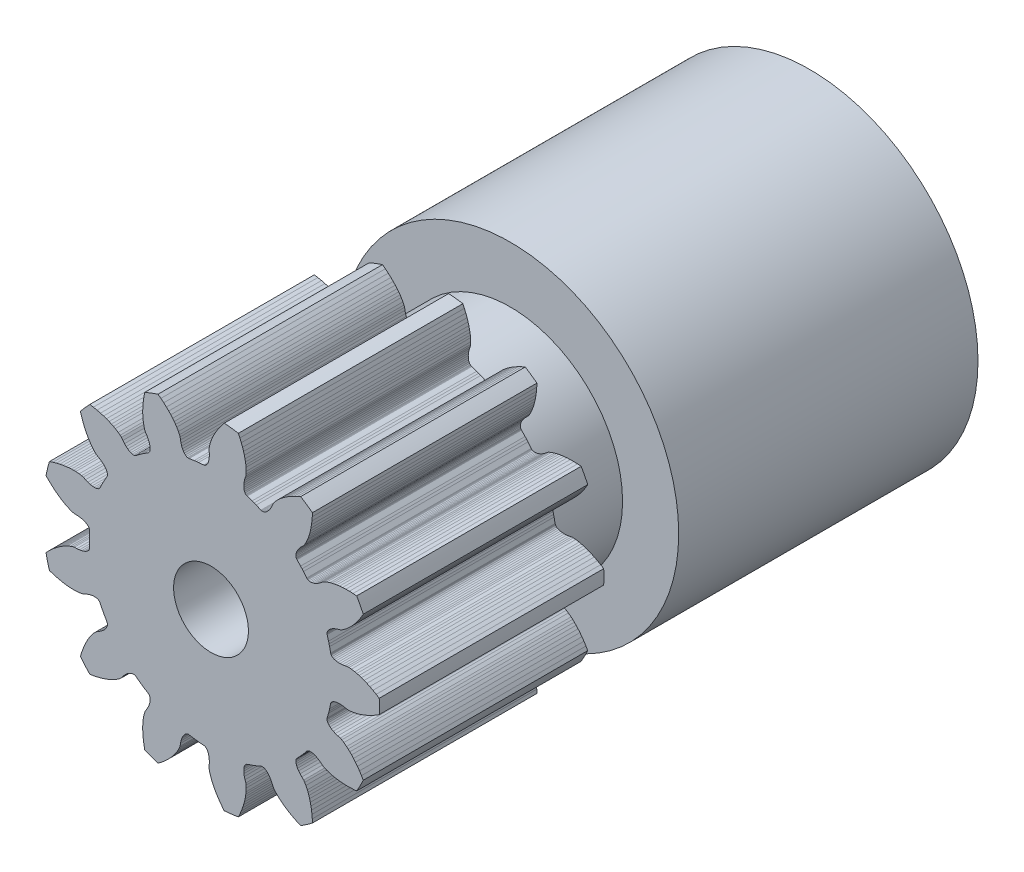
from build123d import *

# Parameters (mm, degrees)
MODEL_R                  = 1
BOSS_EXTRUDE1_DEPTH      = 6
SKETCH2_R                = 3
BOSS_EXTRUDE2_DEPTH      = 3
BOSS_EXTRUDE3_DEPTH      = 7
BOSS_EXTRUDE3_DEPTH_BACK = 1
SKETCH3_R                = 4.5
SKETCH3_R_2              = 3


with BuildPart() as part:
    # Model → Boss-Extrude1 (new body)
    with BuildSketch(Plane.XY):
        with BuildLine():
            Line((4.020960449, 1.838162727), (3.967506849, 1.754550827))
            Line((3.967506849, 1.754550827), (3.913165949, 1.676920427))
            Line((3.913165949, 1.676920427), (3.860130649, 1.607531927))
            Line((3.860130649, 1.607531927), (3.808930749, 1.546031927))
            Line((3.808930749, 1.546031927), (3.757913049, 1.489726527))
            Line((3.757913049, 1.489726527), (3.710533949, 1.441640627))
            Line((3.710533949, 1.441640627), (3.665075249, 1.399218927))
            Line((3.665075249, 1.399218927), (3.622763049, 1.362918127))
            Line((3.622763049, 1.362918127), (3.550404849, 1.308160527))
            Line((3.550404849, 1.308160527), (3.494773449, 1.272871627))
            Line((3.494773449, 1.272871627), (3.453410849, 1.251563727))
            Line((3.453410849, 1.251563727), (3.388067149, 1.234201427))
            Line((3.388067149, 1.234201427), (3.324147749, 1.211896427))
            Line((3.324147749, 1.211896427), (3.268050149, 1.186688927))
            Line((3.268050149, 1.186688927), (3.219890549, 1.159194627))
            Line((3.219890549, 1.159194627), (3.179772749, 1.130036527))
            Line((3.179772749, 1.130036527), (3.147718349, 1.099837927))
            Line((3.147718349, 1.099837927), (3.123739049, 1.069219527))
            Line((3.123739049, 1.069219527), (3.107802849, 1.038812227))
            Line((3.107802849, 1.038812227), (3.099841649, 1.009227227))
            Line((3.099841649, 1.009227227), (3.098824049, 0.994928227))
            Line((3.098824049, 0.994928227), (3.099745849, 0.981076327))
            Line((3.099745849, 0.981076327), (3.102595049, 0.967720027))
            Line((3.102595049, 0.967720027), (3.141130149, 0.834192027))
            Line((3.141130149, 0.834192027), (3.155560649, 0.777776127))
            Line((3.155560649, 0.777776127), (3.169000849, 0.721116127))
            Line((3.169000849, 0.721116127), (3.196933249, 0.584974827))
            Line((3.196933249, 0.584974827), (3.200617449, 0.571824327))
            Line((3.200617449, 0.571824327), (3.206238549, 0.559130727))
            Line((3.206238549, 0.559130727), (3.213784649, 0.546942427))
            Line((3.213784649, 0.546942427), (3.234582749, 0.524446027))
            Line((3.234582749, 0.524446027), (3.262824449, 0.504927527))
            Line((3.262824449, 0.504927527), (3.298286149, 0.488960127))
            Line((3.298286149, 0.488960127), (3.340702949, 0.477117027))
            Line((3.340702949, 0.477117027), (3.389775949, 0.469942427))
            Line((3.389775949, 0.469942427), (3.445196449, 0.467978327))
            Line((3.445196449, 0.467978327), (3.506582849, 0.471728027))
            Line((3.506582849, 0.471728027), (3.573546349, 0.481682727))
            Line((3.573546349, 0.481682727), (3.639473949, 0.496675927))
            Line((3.639473949, 0.496675927), (3.686001049, 0.497030927))
            Line((3.686001049, 0.497030927), (3.751659749, 0.491637327))
            Line((3.751659749, 0.491637327), (3.841176849, 0.476778427))
            Line((3.841176849, 0.476778427), (3.895512249, 0.464299027))
            Line((3.895512249, 0.464299027), (3.955478349, 0.447862227))
            Line((3.955478349, 0.447862227), (4.019777049, 0.427302527))
            Line((4.019777049, 0.427302527), (4.091117449, 0.401155627))
            Line((4.091117449, 0.401155627), (4.165033149, 0.370493827))
            Line((4.165033149, 0.370493827), (4.244240049, 0.333700127))
            Line((4.244240049, 0.333700127), (4.328433149, 0.290215227))
            Line((4.328433149, 0.290215227), (4.414620349, 0.241021727))
            Line((4.414620349, 0.241021727), (4.495964706, 0.190131327))
            ThreePointArc((4.495964706, 0.190131327), (4.499983142, 3.11e-07), (4.4959647, -0.190130705))
            Line((4.4959647, -0.190130705), (4.414620343, -0.241021105))
            Line((4.414620343, -0.241021105), (4.328433143, -0.290214605))
            Line((4.328433143, -0.290214605), (4.244240043, -0.333699505))
            Line((4.244240043, -0.333699505), (4.165033143, -0.370493205))
            Line((4.165033143, -0.370493205), (4.091117443, -0.401155005))
            Line((4.091117443, -0.401155005), (4.019777043, -0.427301905))
            Line((4.019777043, -0.427301905), (3.955478343, -0.447861605))
            Line((3.955478343, -0.447861605), (3.895512243, -0.464298405))
            Line((3.895512243, -0.464298405), (3.841176843, -0.476777805))
            Line((3.841176843, -0.476777805), (3.751659743, -0.491636705))
            Line((3.751659743, -0.491636705), (3.686001043, -0.497030305))
            Line((3.686001043, -0.497030305), (3.639473943, -0.496675305))
            Line((3.639473943, -0.496675305), (3.573546343, -0.481682105))
            Line((3.573546343, -0.481682105), (3.506582843, -0.471727405))
            Line((3.506582843, -0.471727405), (3.445196443, -0.467977705))
            Line((3.445196443, -0.467977705), (3.389775943, -0.469941805))
            Line((3.389775943, -0.469941805), (3.340702943, -0.477116405))
            Line((3.340702943, -0.477116405), (3.298286143, -0.488959505))
            Line((3.298286143, -0.488959505), (3.262824443, -0.504926905))
            Line((3.262824443, -0.504926905), (3.234582743, -0.524445405))
            Line((3.234582743, -0.524445405), (3.213784643, -0.546941805))
            Line((3.213784643, -0.546941805), (3.206238543, -0.559130105))
            Line((3.206238543, -0.559130105), (3.200617443, -0.571823705))
            Line((3.200617443, -0.571823705), (3.196933243, -0.584974205))
            Line((3.196933243, -0.584974205), (3.169000843, -0.721115505))
            Line((3.169000843, -0.721115505), (3.155560643, -0.777775505))
            Line((3.155560643, -0.777775505), (3.141130143, -0.834191405))
            Line((3.141130143, -0.834191405), (3.102595043, -0.967719405))
            Line((3.102595043, -0.967719405), (3.099745843, -0.981075705))
            Line((3.099745843, -0.981075705), (3.098824043, -0.994927605))
            Line((3.098824043, -0.994927605), (3.099841643, -1.009226605))
            Line((3.099841643, -1.009226605), (3.107802843, -1.038811605))
            Line((3.107802843, -1.038811605), (3.123739043, -1.069218905))
            Line((3.123739043, -1.069218905), (3.147718343, -1.099837305))
            Line((3.147718343, -1.099837305), (3.179772743, -1.130035905))
            Line((3.179772743, -1.130035905), (3.219890543, -1.159194005))
            Line((3.219890543, -1.159194005), (3.268050143, -1.186688305))
            Line((3.268050143, -1.186688305), (3.324147743, -1.211895805))
            Line((3.324147743, -1.211895805), (3.388067143, -1.234200805))
            Line((3.388067143, -1.234200805), (3.453410843, -1.251563105))
            Line((3.453410843, -1.251563105), (3.494773443, -1.272871005))
            Line((3.494773443, -1.272871005), (3.550404843, -1.308159905))
            Line((3.550404843, -1.308159905), (3.622763043, -1.362917505))
            Line((3.622763043, -1.362917505), (3.665075243, -1.399218305))
            Line((3.665075243, -1.399218305), (3.710533943, -1.441640005))
            Line((3.710533943, -1.441640005), (3.757913043, -1.489725905))
            Line((3.757913043, -1.489725905), (3.808930743, -1.546031305))
            Line((3.808930743, -1.546031305), (3.860130643, -1.607531305))
            Line((3.860130643, -1.607531305), (3.913165943, -1.676919805))
            Line((3.913165943, -1.676919805), (3.967506843, -1.754550205))
            Line((3.967506843, -1.754550205), (4.020960443, -1.838162105))
            Line((4.020960443, -1.838162105), (4.069337303, -1.921025984))
            ThreePointArc((4.069337303, -1.921025984), (3.984533848, -2.091253118), (3.892613508, -2.257745022))
            Line((3.892613508, -2.257745022), (3.796942629, -2.264989164))
            Line((3.796942629, -2.264989164), (3.697766229, -2.268494664))
            Line((3.697766229, -2.268494664), (3.603008529, -2.267872064))
            Line((3.603008529, -2.267872064), (3.515775329, -2.263641964))
            Line((3.515775329, -2.263641964), (3.436077029, -2.256441264))
            Line((3.436077029, -2.256441264), (3.360757129, -2.246439664))
            Line((3.360757129, -2.246439664), (3.294268929, -2.234763364))
            Line((3.294268929, -2.234763364), (3.233533029, -2.221449864))
            Line((3.233533029, -2.221449864), (3.179622029, -2.207248764))
            Line((3.179622029, -2.207248764), (3.093453229, -2.178804964))
            Line((3.093453229, -2.178804964), (3.032808829, -2.153067664))
            Line((3.032808829, -2.153067664), (2.991776129, -2.131131164))
            Line((2.991776129, -2.131131164), (2.940367829, -2.087217264))
            Line((2.940367829, -2.087217264), (2.885700729, -2.047283264))
            Line((2.885700729, -2.047283264), (2.833088329, -2.015435464))
            Line((2.833088329, -2.015435464), (2.783103129, -1.991419364))
            Line((2.783103129, -1.991419364), (2.736317029, -1.974966764))
            Line((2.736317029, -1.974966764), (2.693255029, -1.965741264))
            Line((2.693255029, -1.965741264), (2.654434829, -1.963399864))
            Line((2.654434829, -1.963399864), (2.620357329, -1.967558064))
            Line((2.620357329, -1.967558064), (2.591486929, -1.977812264))
            Line((2.591486929, -1.977812264), (2.579141029, -1.985097564))
            Line((2.579141029, -1.985097564), (2.568264729, -1.993724964))
            Line((2.568264729, -1.993724964), (2.558891229, -2.003656964))
            Line((2.558891229, -2.003656964), (2.470890229, -2.111223364))
            Line((2.470890229, -2.111223364), (2.432658329, -2.155147264))
            Line((2.432658329, -2.155147264), (2.393663029, -2.198394864))
            Line((2.393663029, -2.198394864), (2.297488229, -2.298719964))
            Line((2.297488229, -2.298719964), (2.288758529, -2.309222264))
            Line((2.288758529, -2.309222264), (2.281505029, -2.321059164))
            Line((2.281505029, -2.321059164), (2.275760929, -2.334193164))
            Line((2.275760929, -2.334193164), (2.269061429, -2.364089064))
            Line((2.269061429, -2.364089064), (2.269041229, -2.398419364))
            Line((2.269041229, -2.398419364), (2.276044829, -2.436674364))
            Line((2.276044829, -2.436674364), (2.290393529, -2.478310364))
            Line((2.290393529, -2.478310364), (2.312365629, -2.522772164))
            Line((2.312365629, -2.522772164), (2.342231629, -2.569498064))
            Line((2.342231629, -2.569498064), (2.380189029, -2.617888064))
            Line((2.380189029, -2.617888064), (2.426421229, -2.667343064))
            Line((2.426421229, -2.667343064), (2.476211529, -2.713083264))
            Line((2.476211529, -2.713083264), (2.502934029, -2.751172664))
            Line((2.502934029, -2.751172664), (2.535793629, -2.808272564))
            Line((2.535793629, -2.808272564), (2.574416529, -2.890384564))
            Line((2.574416529, -2.890384564), (2.595012229, -2.942190864))
            Line((2.595012229, -2.942190864), (2.615549629, -3.000879064))
            Line((2.615549629, -3.000879064), (2.635155129, -3.065475164))
            Line((2.635155129, -3.065475164), (2.654162529, -3.139040264))
            Line((2.654162529, -3.139040264), (2.670917329, -3.217289564))
            Line((2.670917329, -3.217289564), (2.685631329, -3.303376764))
            Line((2.685631329, -3.303376764), (2.697671129, -3.397368564))
            Line((2.697671129, -3.397368564), (2.706145629, -3.496244364))
            Line((2.706145629, -3.496244364), (2.710472443, -3.592098577))
            ThreePointArc((2.710472443, -3.592098577), (2.556281204, -3.703412892), (2.397524485, -3.808113032))
            Line((2.397524485, -3.808113032), (2.309433575, -3.770077019))
            Line((2.309433575, -3.770077019), (2.219988175, -3.727091419))
            Line((2.219988175, -3.727091419), (2.136373775, -3.682504019))
            Line((2.136373775, -3.682504019), (2.061098475, -3.638219219))
            Line((2.061098475, -3.638219219), (1.993875375, -3.594805719))
            Line((1.993875375, -3.594805719), (1.931830975, -3.550946819))
            Line((1.931830975, -3.550946819), (1.878384775, -3.509709319))
            Line((1.878384775, -3.509709319), (1.830792975, -3.469695419))
            Line((1.830792975, -3.469695419), (1.789656675, -3.432067319))
            Line((1.789656675, -3.432067319), (1.726576475, -3.366836919))
            Line((1.726576475, -3.366836919), (1.684839275, -3.315864819))
            Line((1.684839275, -3.315864819), (1.658700975, -3.277372119))
            Line((1.658700975, -3.277372119), (1.633588975, -3.214597619))
            Line((1.633588975, -3.214597619), (1.603741875, -3.153832819))
            Line((1.603741875, -3.153832819), (1.571956375, -3.101182719))
            Line((1.571956375, -3.101182719), (1.538857575, -3.056688319))
            Line((1.538857575, -3.056688319), (1.505076375, -3.020377719))
            Line((1.505076375, -3.020377719), (1.471234175, -2.992197019))
            Line((1.471234175, -2.992197019), (1.437948775, -2.972083119))
            Line((1.437948775, -2.972083119), (1.405842175, -2.959928419))
            Line((1.405842175, -2.959928419), (1.375513375, -2.955591319))
            Line((1.375513375, -2.955591319), (1.361195975, -2.956304719))
            Line((1.361195975, -2.956304719), (1.347556075, -2.958889419))
            Line((1.347556075, -2.958889419), (1.334640675, -2.963327719))
            Line((1.334640675, -2.963327719), (1.206731075, -3.017676919))
            Line((1.206731075, -3.017676919), (1.152465975, -3.038802419))
            Line((1.152465975, -3.038802419), (1.097839075, -3.058974219))
            Line((1.097839075, -3.058974219), (0.966057275, -3.103113019))
            Line((0.966057275, -3.103113019), (0.953446775, -3.108355419))
            Line((0.953446775, -3.108355419), (0.941523275, -3.115465619))
            Line((0.941523275, -3.115465619), (0.930333475, -3.124425819))
            Line((0.930333475, -3.124425819), (0.910507975, -3.147783919))
            Line((0.910507975, -3.147783919), (0.894535975, -3.178172419))
            Line((0.894535975, -3.178172419), (0.882959375, -3.215300219))
            Line((0.882959375, -3.215300219), (0.876315375, -3.258835319))
            Line((0.876315375, -3.258835319), (0.875108275, -3.308415219))
            Line((0.875108275, -3.308415219), (0.879838675, -3.363668419))
            Line((0.879838675, -3.363668419), (0.890960375, -3.424155219))
            Line((0.890960375, -3.424155219), (0.908913975, -3.489430619))
            Line((0.908913975, -3.489430619), (0.931744575, -3.553070319))
            Line((0.931744575, -3.553070319), (0.937705175, -3.599215419))
            Line((0.937705175, -3.599215419), (0.940265175, -3.665045419))
            Line((0.940265175, -3.665045419), (0.936304775, -3.755701019))
            Line((0.936304775, -3.755701019), (0.930465775, -3.811144419))
            Line((0.930465775, -3.811144419), (0.921376975, -3.872654519))
            Line((0.921376975, -3.872654519), (0.908717475, -3.938962619))
            Line((0.908717475, -3.938962619), (0.891360375, -4.012934519))
            Line((0.891360375, -4.012934519), (0.869831675, -4.090007119))
            Line((0.869831675, -4.090007119), (0.842853575, -4.173071519))
            Line((0.842853575, -4.173071519), (0.809834075, -4.261892319))
            Line((0.809834075, -4.261892319), (0.771387975, -4.353380719))
            Line((0.771387975, -4.353380719), (0.730666519, -4.440281399))
            ThreePointArc((0.730666519, -4.440281399), (0.542398565, -4.467189549), (0.353161793, -4.486118774))
            Line((0.353161793, -4.486118774), (0.292859575, -4.411484619))
            Line((0.292859575, -4.411484619), (0.233636075, -4.331855419))
            Line((0.233636075, -4.331855419), (0.180319875, -4.253517719))
            Line((0.180319875, -4.253517719), (0.134247075, -4.179323319))
            Line((0.134247075, -4.179323319), (0.094899275, -4.109642419))
            Line((0.094899275, -4.109642419), (0.060343875, -4.041973819))
            Line((0.060343875, -4.041973819), (0.032183675, -3.980622119))
            Line((0.032183675, -3.980622119), (0.008638675, -3.923074519))
            Line((0.008638675, -3.923074519), (-0.010299125, -3.870639519))
            Line((-0.010299125, -3.870639519), (-0.035839825, -3.783566019))
            Line((-0.035839825, -3.783566019), (-0.049108325, -3.719036219))
            Line((-0.049108325, -3.719036219), (-0.054364125, -3.672805619))
            Line((-0.054364125, -3.672805619), (-0.047426925, -3.605551419))
            Line((-0.047426925, -3.605551419), (-0.045616425, -3.537876219))
            Line((-0.045616425, -3.537876219), (-0.049293425, -3.476485419))
            Line((-0.049293425, -3.476485419), (-0.057923325, -3.421705819))
            Line((-0.057923325, -3.421705819), (-0.070960725, -3.373855419))
            Line((-0.070960725, -3.373855419), (-0.087830225, -3.333175419))
            Line((-0.087830225, -3.333175419), (-0.107955725, -3.299896919))
            Line((-0.107955725, -3.299896919), (-0.130736025, -3.274213819))
            Line((-0.130736025, -3.274213819), (-0.155575325, -3.256279019))
            Line((-0.155575325, -3.256279019), (-0.168584325, -3.250257019))
            Line((-0.168584325, -3.250257019), (-0.181862925, -3.246206919))
            Line((-0.181862925, -3.246206919), (-0.195361625, -3.244134719))
            Line((-0.195361625, -3.244134719), (-0.333877225, -3.232816019))
            Line((-0.333877225, -3.232816019), (-0.391744125, -3.226303419))
            Line((-0.391744125, -3.226303419), (-0.449488125, -3.218778319))
            Line((-0.449488125, -3.218778319), (-0.586687425, -3.196619219))
            Line((-0.586687425, -3.196619219), (-0.600289725, -3.195400719))
            Line((-0.600289725, -3.195400719), (-0.614151825, -3.196155319))
            Line((-0.614151825, -3.196155319), (-0.628223925, -3.198889119))
            Line((-0.628223925, -3.198889119), (-0.656633525, -3.210358319))
            Line((-0.656633525, -3.210358319), (-0.684898225, -3.229843419))
            Line((-0.684898225, -3.229843419), (-0.712402925, -3.257338619))
            Line((-0.712402925, -3.257338619), (-0.738517725, -3.292799319))
            Line((-0.738517725, -3.292799319), (-0.762627525, -3.336139219))
            Line((-0.762627525, -3.336139219), (-0.784116325, -3.387261819))
            Line((-0.784116325, -3.387261819), (-0.802378225, -3.445988719))
            Line((-0.802378225, -3.445988719), (-0.816816025, -3.512130719))
            Line((-0.816816025, -3.512130719), (-0.826175425, -3.579090819))
            Line((-0.826175425, -3.579090819), (-0.842342225, -3.622720219))
            Line((-0.842342225, -3.622720219), (-0.870668225, -3.682199519))
            Line((-0.870668225, -3.682199519), (-0.916304825, -3.760630519))
            Line((-0.916304825, -3.760630519), (-0.947240725, -3.807009719))
            Line((-0.947240725, -3.807009719), (-0.983873725, -3.857250419))
            Line((-0.983873725, -3.857250419), (-1.025898025, -3.910080119))
            Line((-1.025898025, -3.910080119), (-1.075643425, -3.967512719))
            Line((-1.075643425, -3.967512719), (-1.130523625, -4.025752319))
            Line((-1.130523625, -4.025752319), (-1.193013425, -4.086764819))
            Line((-1.193013425, -4.086764819), (-1.263527825, -4.150066819))
            Line((-1.263527825, -4.150066819), (-1.340086925, -4.213209019))
            Line((-1.340086925, -4.213209019), (-1.416515424, -4.271221308))
            ThreePointArc((-1.416515424, -4.271221308), (-1.595716032, -4.207557219), (-1.772066723, -4.136378514))
            Line((-1.772066723, -4.136378514), (-1.790805025, -4.042274219))
            Line((-1.790805025, -4.042274219), (-1.806239325, -3.944243519))
            Line((-1.806239325, -3.944243519), (-1.817043125, -3.850101619))
            Line((-1.817043125, -3.850101619), (-1.823358625, -3.762994619))
            Line((-1.823358625, -3.762994619), (-1.825817025, -3.683009419))
            Line((-1.825817025, -3.683009419), (-1.824967225, -3.607033219))
            Line((-1.824967225, -3.607033219), (-1.821390225, -3.539622319))
            Line((-1.821390225, -3.539622319), (-1.815494625, -3.477724419))
            Line((-1.815494625, -3.477724419), (-1.807895425, -3.422494819))
            Line((-1.807895425, -3.422494819), (-1.790045525, -3.333525719))
            Line((-1.790045525, -3.333525719), (-1.771805725, -3.270221219))
            Line((-1.771805725, -3.270221219), (-1.754975125, -3.226843519))
            Line((-1.754975125, -3.226843519), (-1.717577925, -3.170516819))
            Line((-1.717577925, -3.170516819), (-1.684524625, -3.111434719))
            Line((-1.684524625, -3.111434719), (-1.659250625, -3.055367119))
            Line((-1.659250625, -3.055367119), (-1.641434725, -3.002851619))
            Line((-1.641434725, -3.002851619), (-1.630741525, -2.954423519))
            Line((-1.630741525, -2.954423519), (-1.626773825, -2.910563419))
            Line((-1.626773825, -2.910563419), (-1.629128825, -2.871744019))
            Line((-1.629128825, -2.871744019), (-1.637364225, -2.838416219))
            Line((-1.637364225, -2.838416219), (-1.651023625, -2.810992319))
            Line((-1.651023625, -2.810992319), (-1.659743925, -2.799614519))
            Line((-1.659743925, -2.799614519), (-1.669619425, -2.789857519))
            Line((-1.669619425, -2.789857519), (-1.680608925, -2.781749519))
            Line((-1.680608925, -2.781749519), (-1.797998325, -2.707355919))
            Line((-1.797998325, -2.707355919), (-1.846210325, -2.674697219))
            Line((-1.846210325, -2.674697219), (-1.893843025, -2.641199019))
            Line((-1.893843025, -2.641199019), (-2.005029125, -2.557818419))
            Line((-2.005029125, -2.557818419), (-2.016507125, -2.550418219))
            Line((-2.016507125, -2.550418219), (-2.029132025, -2.544644419))
            Line((-2.029132025, -2.544644419), (-2.042862725, -2.540525319))
            Line((-2.042862725, -2.540525319), (-2.073348125, -2.537478219))
            Line((-2.073348125, -2.537478219), (-2.107430525, -2.541596219))
            Line((-2.107430525, -2.541596219), (-2.144562425, -2.553159819))
            Line((-2.144562425, -2.553159819), (-2.184165325, -2.572422619))
            Line((-2.184165325, -2.572422619), (-2.225654525, -2.599593819))
            Line((-2.225654525, -2.599593819), (-2.268439725, -2.634874219))
            Line((-2.268439725, -2.634874219), (-2.311901625, -2.678387619))
            Line((-2.311901625, -2.678387619), (-2.355423425, -2.730243819))
            Line((-2.355423425, -2.730243819), (-2.394828625, -2.785184519))
            Line((-2.394828625, -2.785184519), (-2.429419225, -2.816303419))
            Line((-2.429419225, -2.816303419), (-2.482142025, -2.855806019))
            Line((-2.482142025, -2.855806019), (-2.558999925, -2.904044819))
            Line((-2.558999925, -2.904044819), (-2.607945825, -2.930734919))
            Line((-2.607945825, -2.930734919), (-2.663730725, -2.958196719))
            Line((-2.663730725, -2.958196719), (-2.725492625, -2.985445419))
            Line((-2.725492625, -2.985445419), (-2.796230225, -3.013181519))
            Line((-2.796230225, -3.013181519), (-2.871889425, -3.039246019))
            Line((-2.871889425, -3.039246019), (-2.955575425, -3.064229519))
            Line((-2.955575425, -3.064229519), (-3.047430725, -3.087510919))
            Line((-3.047430725, -3.087510919), (-3.144564125, -3.107841819))
            Line((-3.144564125, -3.107841819), (-3.239221247, -3.123707795))
            ThreePointArc((-3.239221247, -3.123707795), (-3.368314838, -2.984051642), (-3.491392233, -2.839065604))
            Line((-3.491392233, -2.839065604), (-3.464217725, -2.747027419))
            Line((-3.464217725, -2.747027419), (-3.432327025, -2.653052819))
            Line((-3.432327025, -2.653052819), (-3.398143325, -2.564673519))
            Line((-3.398143325, -2.564673519), (-3.363254925, -2.484609219))
            Line((-3.363254925, -2.484609219), (-3.328260725, -2.412643319))
            Line((-3.328260725, -2.412643319), (-3.292200225, -2.345764619))
            Line((-3.292200225, -2.345764619), (-3.257705625, -2.287737519))
            Line((-3.257705625, -2.287737519), (-3.223720025, -2.235669519))
            Line((-3.223720025, -2.235669519), (-3.191324725, -2.190297619))
            Line((-3.191324725, -2.190297619), (-3.134173425, -2.119814719))
            Line((-3.134173425, -2.119814719), (-3.088603825, -2.072237819))
            Line((-3.088603825, -2.072237819), (-3.053542425, -2.041650319))
            Line((-3.053542425, -2.041650319), (-2.994252525, -2.009154819))
            Line((-2.994252525, -2.009154819), (-2.937528425, -1.972201019))
            Line((-2.937528425, -1.972201019), (-2.889093525, -1.934300919))
            Line((-2.889093525, -1.934300919), (-2.848913225, -1.896080219))
            Line((-2.848913225, -1.896080219), (-2.816939125, -1.858168619))
            Line((-2.816939125, -1.858168619), (-2.793043125, -1.821176319))
            Line((-2.793043125, -1.821176319), (-2.777088025, -1.785709119))
            Line((-2.777088025, -1.785709119), (-2.768892025, -1.752371519))
            Line((-2.768892025, -1.752371519), (-2.768242225, -1.721741119))
            Line((-2.768242225, -1.721741119), (-2.770676225, -1.707614019))
            Line((-2.770676225, -1.707614019), (-2.774886125, -1.694385219))
            Line((-2.774886125, -1.694385219), (-2.780848925, -1.682098919))
            Line((-2.780848925, -1.682098919), (-2.850219625, -1.561673019))
            Line((-2.850219625, -1.561673019), (-2.877732025, -1.510349919))
            Line((-2.877732025, -1.510349919), (-2.904341225, -1.458552819))
            Line((-2.904341225, -1.458552819), (-2.964042725, -1.333052119))
            Line((-2.964042725, -1.333052119), (-2.970767025, -1.321165519))
            Line((-2.970767025, -1.321165519), (-2.979262525, -1.310185919))
            Line((-2.979262525, -1.310185919), (-2.989506225, -1.300157719))
            Line((-2.989506225, -1.300157719), (-3.015083725, -1.283292419))
            Line((-3.015083725, -1.283292419), (-3.047175925, -1.271099719))
            Line((-3.047175925, -1.271099719), (-3.085428425, -1.264082819))
            Line((-3.085428425, -1.264082819), (-3.129446925, -1.262734819))
            Line((-3.129446925, -1.262734819), (-3.178810825, -1.267512719))
            Line((-3.178810825, -1.267512719), (-3.233090925, -1.278868719))
            Line((-3.233090925, -1.278868719), (-3.291796225, -1.297200119))
            Line((-3.291796225, -1.297200119), (-3.354431625, -1.322891019))
            Line((-3.354431625, -1.322891019), (-3.414855425, -1.353226019))
            Line((-3.414855425, -1.353226019), (-3.459945525, -1.364705319))
            Line((-3.459945525, -1.364705319), (-3.524987025, -1.375181619))
            Line((-3.524987025, -1.375181619), (-3.615458925, -1.382177319))
            Line((-3.615458925, -1.382177319), (-3.671201925, -1.383063919))
            Line((-3.671201925, -1.383063919), (-3.733359125, -1.381455619))
            Line((-3.733359125, -1.381455619), (-3.800709625, -1.376880919))
            Line((-3.800709625, -1.376880919), (-3.876234425, -1.368566719))
            Line((-3.876234425, -1.368566719), (-3.955340125, -1.356485119))
            Line((-3.955340125, -1.356485119), (-4.041050725, -1.339716019))
            Line((-4.041050725, -1.339716019), (-4.133203925, -1.317643419))
            Line((-4.133203925, -1.317643419), (-4.228659525, -1.290505319))
            Line((-4.228659525, -1.290505319), (-4.319818995, -1.260560712))
            ThreePointArc((-4.319818995, -1.260560712), (-4.36922202, -1.07691614), (-4.410821696, -0.891348216))
            Line((-4.410821696, -0.891348216), (-4.344019925, -0.822469619))
            Line((-4.344019925, -0.822469619), (-4.272109925, -0.754079619))
            Line((-4.272109925, -0.754079619), (-4.200769925, -0.691709619))
            Line((-4.200769925, -0.691709619), (-4.132669925, -0.637029619))
            Line((-4.132669925, -0.637029619), (-4.068239925, -0.589569619))
            Line((-4.068239925, -0.589569619), (-4.005229925, -0.547109619))
            Line((-4.005229925, -0.547109619), (-3.947719925, -0.511759619))
            Line((-3.947719925, -0.511759619), (-3.893429925, -0.481449619))
            Line((-3.893429925, -0.481449619), (-3.843659925, -0.456329619))
            Line((-3.843659925, -0.456329619), (-3.760299925, -0.420479619))
            Line((-3.760299925, -0.420479619), (-3.697839925, -0.399529619))
            Line((-3.697839925, -0.399529619), (-3.652579925, -0.388739619))
            Line((-3.652579925, -0.388739619), (-3.584979925, -0.387519619))
            Line((-3.584979925, -0.387519619), (-3.517579925, -0.381159619))
            Line((-3.517579925, -0.381159619), (-3.457079925, -0.370109619))
            Line((-3.457079925, -0.370109619), (-3.403739925, -0.354939619))
            Line((-3.403739925, -0.354939619), (-3.357809925, -0.336229619))
            Line((-3.357809925, -0.336229619), (-3.319459925, -0.314579619))
            Line((-3.319459925, -0.314579619), (-3.288849925, -0.290589619))
            Line((-3.288849925, -0.290589619), (-3.266099925, -0.264879619))
            Line((-3.266099925, -0.264879619), (-3.251289925, -0.238059619))
            Line((-3.251289925, -0.238059619), (-3.246879925, -0.224419619))
            Line((-3.246879925, -0.224419619), (-3.244459925, -0.210749619))
            Line((-3.244459925, -0.210749619), (-3.244029925, -0.197099619))
            Line((-3.244029925, -0.197099619), (-3.249489925, -0.058229619))
            Line((-3.249489925, -0.058229619), (-3.249999925, 3.81e-07))
            Line((-3.249999925, 3.81e-07), (-3.249489925, 0.058230381))
            Line((-3.249489925, 0.058230381), (-3.244029925, 0.197100381))
            Line((-3.244029925, 0.197100381), (-3.244459925, 0.210750381))
            Line((-3.244459925, 0.210750381), (-3.246879925, 0.224420381))
            Line((-3.246879925, 0.224420381), (-3.251289925, 0.238060381))
            Line((-3.251289925, 0.238060381), (-3.266099925, 0.264880381))
            Line((-3.266099925, 0.264880381), (-3.288849925, 0.290590381))
            Line((-3.288849925, 0.290590381), (-3.319459925, 0.314580381))
            Line((-3.319459925, 0.314580381), (-3.357809925, 0.336230381))
            Line((-3.357809925, 0.336230381), (-3.403739925, 0.354940381))
            Line((-3.403739925, 0.354940381), (-3.457079925, 0.370110381))
            Line((-3.457079925, 0.370110381), (-3.517579925, 0.381160381))
            Line((-3.517579925, 0.381160381), (-3.584979925, 0.387520381))
            Line((-3.584979925, 0.387520381), (-3.652579925, 0.388740381))
            Line((-3.652579925, 0.388740381), (-3.697839925, 0.399530381))
            Line((-3.697839925, 0.399530381), (-3.760299925, 0.420480381))
            Line((-3.760299925, 0.420480381), (-3.843659925, 0.456330381))
            Line((-3.843659925, 0.456330381), (-3.893429925, 0.481450381))
            Line((-3.893429925, 0.481450381), (-3.947719925, 0.511760381))
            Line((-3.947719925, 0.511760381), (-4.005229925, 0.547110381))
            Line((-4.005229925, 0.547110381), (-4.068239925, 0.589570381))
            Line((-4.068239925, 0.589570381), (-4.132669925, 0.637030381))
            Line((-4.132669925, 0.637030381), (-4.200769925, 0.691710381))
            Line((-4.200769925, 0.691710381), (-4.272109925, 0.754080381))
            Line((-4.272109925, 0.754080381), (-4.344019925, 0.822470381))
            Line((-4.344019925, 0.822470381), (-4.41085591, 0.891345384))
            ThreePointArc((-4.41085591, 0.891345384), (-4.369254636, 1.076921143), (-4.319849356, 1.260573388))
            Line((-4.319849356, 1.260573388), (-4.228659525, 1.290506081))
            Line((-4.228659525, 1.290506081), (-4.133203925, 1.317644181))
            Line((-4.133203925, 1.317644181), (-4.041050725, 1.339716781))
            Line((-4.041050725, 1.339716781), (-3.955340125, 1.356485881))
            Line((-3.955340125, 1.356485881), (-3.876234425, 1.368567481))
            Line((-3.876234425, 1.368567481), (-3.800709625, 1.376881681))
            Line((-3.800709625, 1.376881681), (-3.733359125, 1.381456381))
            Line((-3.733359125, 1.381456381), (-3.671201925, 1.383064681))
            Line((-3.671201925, 1.383064681), (-3.615458925, 1.382178081))
            Line((-3.615458925, 1.382178081), (-3.524987025, 1.375182381))
            Line((-3.524987025, 1.375182381), (-3.459945525, 1.364706081))
            Line((-3.459945525, 1.364706081), (-3.414855425, 1.353226781))
            Line((-3.414855425, 1.353226781), (-3.354431625, 1.322891781))
            Line((-3.354431625, 1.322891781), (-3.291796225, 1.297200881))
            Line((-3.291796225, 1.297200881), (-3.233090925, 1.278869481))
            Line((-3.233090925, 1.278869481), (-3.178810825, 1.267513481))
            Line((-3.178810825, 1.267513481), (-3.129446925, 1.262735581))
            Line((-3.129446925, 1.262735581), (-3.085428425, 1.264083581))
            Line((-3.085428425, 1.264083581), (-3.047175925, 1.271100481))
            Line((-3.047175925, 1.271100481), (-3.015083725, 1.283293181))
            Line((-3.015083725, 1.283293181), (-2.989506225, 1.300158481))
            Line((-2.989506225, 1.300158481), (-2.979262525, 1.310186681))
            Line((-2.979262525, 1.310186681), (-2.970767025, 1.321166281))
            Line((-2.970767025, 1.321166281), (-2.964042725, 1.333052881))
            Line((-2.964042725, 1.333052881), (-2.904341225, 1.458553581))
            Line((-2.904341225, 1.458553581), (-2.877732025, 1.510350681))
            Line((-2.877732025, 1.510350681), (-2.850219625, 1.561673781))
            Line((-2.850219625, 1.561673781), (-2.780848925, 1.682099681))
            Line((-2.780848925, 1.682099681), (-2.774886125, 1.694385981))
            Line((-2.774886125, 1.694385981), (-2.770676225, 1.707614781))
            Line((-2.770676225, 1.707614781), (-2.768242225, 1.721741881))
            Line((-2.768242225, 1.721741881), (-2.768892025, 1.752372281))
            Line((-2.768892025, 1.752372281), (-2.777088025, 1.785709881))
            Line((-2.777088025, 1.785709881), (-2.793043125, 1.821177081))
            Line((-2.793043125, 1.821177081), (-2.816939125, 1.858169381))
            Line((-2.816939125, 1.858169381), (-2.848913225, 1.896080981))
            Line((-2.848913225, 1.896080981), (-2.889093525, 1.934301681))
            Line((-2.889093525, 1.934301681), (-2.937528425, 1.972201781))
            Line((-2.937528425, 1.972201781), (-2.994252525, 2.009155581))
            Line((-2.994252525, 2.009155581), (-3.053542425, 2.041651081))
            Line((-3.053542425, 2.041651081), (-3.088603825, 2.072238581))
            Line((-3.088603825, 2.072238581), (-3.134173425, 2.119815481))
            Line((-3.134173425, 2.119815481), (-3.191324725, 2.190298381))
            Line((-3.191324725, 2.190298381), (-3.223720025, 2.235670281))
            Line((-3.223720025, 2.235670281), (-3.257705625, 2.287738281))
            Line((-3.257705625, 2.287738281), (-3.292200225, 2.345765381))
            Line((-3.292200225, 2.345765381), (-3.328260725, 2.412644081))
            Line((-3.328260725, 2.412644081), (-3.363254925, 2.484609981))
            Line((-3.363254925, 2.484609981), (-3.398143325, 2.564674281))
            Line((-3.398143325, 2.564674281), (-3.432327025, 2.653053581))
            Line((-3.432327025, 2.653053581), (-3.464217725, 2.747028181))
            Line((-3.464217725, 2.747028181), (-3.49135833, 2.839061487))
            ThreePointArc((-3.49135833, 2.839061487), (-3.36828584, 2.984041167), (-3.239197667, 3.123691405))
            Line((-3.239197667, 3.123691405), (-3.144563963, 3.107842203))
            Line((-3.144563963, 3.107842203), (-3.047430563, 3.087511303))
            Line((-3.047430563, 3.087511303), (-2.955575263, 3.064229903))
            Line((-2.955575263, 3.064229903), (-2.871889263, 3.039246403))
            Line((-2.871889263, 3.039246403), (-2.796230063, 3.013181903))
            Line((-2.796230063, 3.013181903), (-2.725492463, 2.985445803))
            Line((-2.725492463, 2.985445803), (-2.663730563, 2.958197103))
            Line((-2.663730563, 2.958197103), (-2.607945663, 2.930735303))
            Line((-2.607945663, 2.930735303), (-2.558999763, 2.904045203))
            Line((-2.558999763, 2.904045203), (-2.482141863, 2.855806403))
            Line((-2.482141863, 2.855806403), (-2.429419063, 2.816303803))
            Line((-2.429419063, 2.816303803), (-2.394828463, 2.785184903))
            Line((-2.394828463, 2.785184903), (-2.355423263, 2.730244203))
            Line((-2.355423263, 2.730244203), (-2.311901463, 2.678388003))
            Line((-2.311901463, 2.678388003), (-2.268439563, 2.634874603))
            Line((-2.268439563, 2.634874603), (-2.225654363, 2.599594203))
            Line((-2.225654363, 2.599594203), (-2.184165163, 2.572423003))
            Line((-2.184165163, 2.572423003), (-2.144562263, 2.553160203))
            Line((-2.144562263, 2.553160203), (-2.107430363, 2.541596603))
            Line((-2.107430363, 2.541596603), (-2.073347963, 2.537478603))
            Line((-2.073347963, 2.537478603), (-2.042862563, 2.540525703))
            Line((-2.042862563, 2.540525703), (-2.029131863, 2.544644803))
            Line((-2.029131863, 2.544644803), (-2.016506963, 2.550418603))
            Line((-2.016506963, 2.550418603), (-2.005028963, 2.557818803))
            Line((-2.005028963, 2.557818803), (-1.893842863, 2.641199403))
            Line((-1.893842863, 2.641199403), (-1.846210163, 2.674697603))
            Line((-1.846210163, 2.674697603), (-1.797998163, 2.707356303))
            Line((-1.797998163, 2.707356303), (-1.680608763, 2.781749903))
            Line((-1.680608763, 2.781749903), (-1.669619263, 2.789857903))
            Line((-1.669619263, 2.789857903), (-1.659743763, 2.799614903))
            Line((-1.659743763, 2.799614903), (-1.651023463, 2.810992703))
            Line((-1.651023463, 2.810992703), (-1.637364063, 2.838416603))
            Line((-1.637364063, 2.838416603), (-1.629128663, 2.871744403))
            Line((-1.629128663, 2.871744403), (-1.626773663, 2.910563803))
            Line((-1.626773663, 2.910563803), (-1.630741363, 2.954423903))
            Line((-1.630741363, 2.954423903), (-1.641434563, 3.002852003))
            Line((-1.641434563, 3.002852003), (-1.659250463, 3.055367503))
            Line((-1.659250463, 3.055367503), (-1.684524463, 3.111435103))
            Line((-1.684524463, 3.111435103), (-1.717577763, 3.170517203))
            Line((-1.717577763, 3.170517203), (-1.754974963, 3.226843903))
            Line((-1.754974963, 3.226843903), (-1.771805563, 3.270221603))
            Line((-1.771805563, 3.270221603), (-1.790045363, 3.333526103))
            Line((-1.790045363, 3.333526103), (-1.807895263, 3.422495203))
            Line((-1.807895263, 3.422495203), (-1.815494463, 3.477724803))
            Line((-1.815494463, 3.477724803), (-1.821390063, 3.539622703))
            Line((-1.821390063, 3.539622703), (-1.824967063, 3.607033603))
            Line((-1.824967063, 3.607033603), (-1.825816863, 3.683009803))
            Line((-1.825816863, 3.683009803), (-1.823358463, 3.762995003))
            Line((-1.823358463, 3.762995003), (-1.817042963, 3.850102003))
            Line((-1.817042963, 3.850102003), (-1.806239163, 3.944243903))
            Line((-1.806239163, 3.944243903), (-1.790804863, 4.042274603))
            Line((-1.790804863, 4.042274603), (-1.772095691, 4.136391529))
            ThreePointArc((-1.772095691, 4.136391529), (-1.595738395, 4.207573079), (-1.416530966, 4.271239445))
            Line((-1.416530966, 4.271239445), (-1.340086843, 4.213209375))
            Line((-1.340086843, 4.213209375), (-1.263527743, 4.150067175))
            Line((-1.263527743, 4.150067175), (-1.193013343, 4.086765175))
            Line((-1.193013343, 4.086765175), (-1.130523543, 4.025752675))
            Line((-1.130523543, 4.025752675), (-1.075643343, 3.967513075))
            Line((-1.075643343, 3.967513075), (-1.025897943, 3.910080475))
            Line((-1.025897943, 3.910080475), (-0.983873643, 3.857250775))
            Line((-0.983873643, 3.857250775), (-0.947240643, 3.807010075))
            Line((-0.947240643, 3.807010075), (-0.916304743, 3.760630875))
            Line((-0.916304743, 3.760630875), (-0.870668143, 3.682199875))
            Line((-0.870668143, 3.682199875), (-0.842342143, 3.622720575))
            Line((-0.842342143, 3.622720575), (-0.826175343, 3.579091175))
            Line((-0.826175343, 3.579091175), (-0.816815943, 3.512131075))
            Line((-0.816815943, 3.512131075), (-0.802378143, 3.445989075))
            Line((-0.802378143, 3.445989075), (-0.784116243, 3.387262175))
            Line((-0.784116243, 3.387262175), (-0.762627443, 3.336139575))
            Line((-0.762627443, 3.336139575), (-0.738517643, 3.292799675))
            Line((-0.738517643, 3.292799675), (-0.712402843, 3.257338975))
            Line((-0.712402843, 3.257338975), (-0.684898143, 3.229843775))
            Line((-0.684898143, 3.229843775), (-0.656633443, 3.210358675))
            Line((-0.656633443, 3.210358675), (-0.628223843, 3.198889475))
            Line((-0.628223843, 3.198889475), (-0.614151743, 3.196155675))
            Line((-0.614151743, 3.196155675), (-0.600289643, 3.195401075))
            Line((-0.600289643, 3.195401075), (-0.586687343, 3.196619575))
            Line((-0.586687343, 3.196619575), (-0.449488043, 3.218778675))
            Line((-0.449488043, 3.218778675), (-0.391744043, 3.226303775))
            Line((-0.391744043, 3.226303775), (-0.333877143, 3.232816375))
            Line((-0.333877143, 3.232816375), (-0.195361543, 3.244135075))
            Line((-0.195361543, 3.244135075), (-0.181862843, 3.246207275))
            Line((-0.181862843, 3.246207275), (-0.168584243, 3.250257375))
            Line((-0.168584243, 3.250257375), (-0.155575243, 3.256279375))
            Line((-0.155575243, 3.256279375), (-0.130735943, 3.274214175))
            Line((-0.130735943, 3.274214175), (-0.107955643, 3.299897275))
            Line((-0.107955643, 3.299897275), (-0.087830143, 3.333175775))
            Line((-0.087830143, 3.333175775), (-0.070960643, 3.373855775))
            Line((-0.070960643, 3.373855775), (-0.057923243, 3.421706175))
            Line((-0.057923243, 3.421706175), (-0.049293343, 3.476485775))
            Line((-0.049293343, 3.476485775), (-0.045616343, 3.537876575))
            Line((-0.045616343, 3.537876575), (-0.047426843, 3.605551775))
            Line((-0.047426843, 3.605551775), (-0.054364043, 3.672805975))
            Line((-0.054364043, 3.672805975), (-0.049108243, 3.719036575))
            Line((-0.049108243, 3.719036575), (-0.035839743, 3.783566375))
            Line((-0.035839743, 3.783566375), (-0.010299043, 3.870639875))
            Line((-0.010299043, 3.870639875), (0.008638757, 3.923074875))
            Line((0.008638757, 3.923074875), (0.032183757, 3.980622475))
            Line((0.032183757, 3.980622475), (0.060343957, 4.041974175))
            Line((0.060343957, 4.041974175), (0.094899357, 4.109642775))
            Line((0.094899357, 4.109642775), (0.134247157, 4.179323675))
            Line((0.134247157, 4.179323675), (0.180319957, 4.253518075))
            Line((0.180319957, 4.253518075), (0.233636157, 4.331855775))
            Line((0.233636157, 4.331855775), (0.292859657, 4.411484975))
            Line((0.292859657, 4.411484975), (0.353184061, 4.486102081))
            ThreePointArc((0.353184061, 4.486102081), (0.5424132, 4.467173484), (0.730673601, 4.440266604))
            Line((0.730673601, 4.440266604), (0.7713879, 4.3533811))
            Line((0.7713879, 4.3533811), (0.809834, 4.2618927))
            Line((0.809834, 4.2618927), (0.8428535, 4.1730719))
            Line((0.8428535, 4.1730719), (0.8698316, 4.0900075))
            Line((0.8698316, 4.0900075), (0.8913603, 4.0129349))
            Line((0.8913603, 4.0129349), (0.9087174, 3.938963))
            Line((0.9087174, 3.938963), (0.9213769, 3.8726549))
            Line((0.9213769, 3.8726549), (0.9304657, 3.8111448))
            Line((0.9304657, 3.8111448), (0.9363047, 3.7557014))
            Line((0.9363047, 3.7557014), (0.9402651, 3.6650458))
            Line((0.9402651, 3.6650458), (0.9377051, 3.5992158))
            Line((0.9377051, 3.5992158), (0.9317445, 3.5530707))
            Line((0.9317445, 3.5530707), (0.9089139, 3.489431))
            Line((0.9089139, 3.489431), (0.8909603, 3.4241556))
            Line((0.8909603, 3.4241556), (0.8798386, 3.3636688))
            Line((0.8798386, 3.3636688), (0.8751082, 3.3084156))
            Line((0.8751082, 3.3084156), (0.8763153, 3.2588357))
            Line((0.8763153, 3.2588357), (0.8829593, 3.2153006))
            Line((0.8829593, 3.2153006), (0.8945359, 3.1781728))
            Line((0.8945359, 3.1781728), (0.9105079, 3.1477843))
            Line((0.9105079, 3.1477843), (0.9303334, 3.1244262))
            Line((0.9303334, 3.1244262), (0.9415232, 3.115466))
            Line((0.9415232, 3.115466), (0.9534467, 3.1083558))
            Line((0.9534467, 3.1083558), (0.9660572, 3.1031134))
            Line((0.9660572, 3.1031134), (1.097839, 3.0589746))
            Line((1.097839, 3.0589746), (1.1524659, 3.0388028))
            Line((1.1524659, 3.0388028), (1.206731, 3.0176773))
            Line((1.206731, 3.0176773), (1.3346406, 2.9633281))
            Line((1.3346406, 2.9633281), (1.347556, 2.9588898))
            Line((1.347556, 2.9588898), (1.3611959, 2.9563051))
            Line((1.3611959, 2.9563051), (1.3755133, 2.9555917))
            Line((1.3755133, 2.9555917), (1.4058421, 2.9599288))
            Line((1.4058421, 2.9599288), (1.4379487, 2.9720835))
            Line((1.4379487, 2.9720835), (1.4712341, 2.9921974))
            Line((1.4712341, 2.9921974), (1.5050763, 3.0203781))
            Line((1.5050763, 3.0203781), (1.5388575, 3.0566887))
            Line((1.5388575, 3.0566887), (1.5719563, 3.1011831))
            Line((1.5719563, 3.1011831), (1.6037418, 3.1538332))
            Line((1.6037418, 3.1538332), (1.6335889, 3.214598))
            Line((1.6335889, 3.214598), (1.6587009, 3.2773725))
            Line((1.6587009, 3.2773725), (1.6848392, 3.3158652))
            Line((1.6848392, 3.3158652), (1.7265764, 3.3668373))
            Line((1.7265764, 3.3668373), (1.7896566, 3.4320677))
            Line((1.7896566, 3.4320677), (1.8307929, 3.4696958))
            Line((1.8307929, 3.4696958), (1.8783847, 3.5097097))
            Line((1.8783847, 3.5097097), (1.9318309, 3.5509472))
            Line((1.9318309, 3.5509472), (1.9938753, 3.5948061))
            Line((1.9938753, 3.5948061), (2.0610984, 3.6382196))
            Line((2.0610984, 3.6382196), (2.1363737, 3.6825044))
            Line((2.1363737, 3.6825044), (2.2199881, 3.7270918))
            Line((2.2199881, 3.7270918), (2.3094335, 3.7700774))
            Line((2.3094335, 3.7700774), (2.397524409, 3.808113413))
            ThreePointArc((2.397524409, 3.808113413), (2.556282135, 3.703414062), (2.710474402, 3.592100475))
            Line((2.710474402, 3.592100475), (2.706147588, 3.496246262))
            Line((2.706147588, 3.496246262), (2.697673088, 3.397370462))
            Line((2.697673088, 3.397370462), (2.685633288, 3.303378662))
            Line((2.685633288, 3.303378662), (2.670919288, 3.217291462))
            Line((2.670919288, 3.217291462), (2.654164488, 3.139042162))
            Line((2.654164488, 3.139042162), (2.635157088, 3.065477062))
            Line((2.635157088, 3.065477062), (2.615551588, 3.000880962))
            Line((2.615551588, 3.000880962), (2.595014188, 2.942192762))
            Line((2.595014188, 2.942192762), (2.574418488, 2.890386462))
            Line((2.574418488, 2.890386462), (2.535795588, 2.808274462))
            Line((2.535795588, 2.808274462), (2.502935988, 2.751174562))
            Line((2.502935988, 2.751174562), (2.476213488, 2.713085162))
            Line((2.476213488, 2.713085162), (2.426423188, 2.667344962))
            Line((2.426423188, 2.667344962), (2.380190988, 2.617889962))
            Line((2.380190988, 2.617889962), (2.342233588, 2.569499962))
            Line((2.342233588, 2.569499962), (2.312367588, 2.522774062))
            Line((2.312367588, 2.522774062), (2.290395488, 2.478312262))
            Line((2.290395488, 2.478312262), (2.276046788, 2.436676262))
            Line((2.276046788, 2.436676262), (2.269043188, 2.398421262))
            Line((2.269043188, 2.398421262), (2.269063388, 2.364090962))
            Line((2.269063388, 2.364090962), (2.275762888, 2.334195062))
            Line((2.275762888, 2.334195062), (2.281506988, 2.321061062))
            Line((2.281506988, 2.321061062), (2.288760488, 2.309224162))
            Line((2.288760488, 2.309224162), (2.297490188, 2.298721862))
            Line((2.297490188, 2.298721862), (2.393664988, 2.198396762))
            Line((2.393664988, 2.198396762), (2.432660288, 2.155149162))
            Line((2.432660288, 2.155149162), (2.470892188, 2.111225262))
            Line((2.470892188, 2.111225262), (2.558893188, 2.003658862))
            Line((2.558893188, 2.003658862), (2.568266688, 1.993726862))
            Line((2.568266688, 1.993726862), (2.579142988, 1.985099462))
            Line((2.579142988, 1.985099462), (2.591488888, 1.977814162))
            Line((2.591488888, 1.977814162), (2.620359288, 1.967559962))
            Line((2.620359288, 1.967559962), (2.654436788, 1.963401762))
            Line((2.654436788, 1.963401762), (2.693256988, 1.965743162))
            Line((2.693256988, 1.965743162), (2.736318988, 1.974968662))
            Line((2.736318988, 1.974968662), (2.783105088, 1.991421262))
            Line((2.783105088, 1.991421262), (2.833090288, 2.015437362))
            Line((2.833090288, 2.015437362), (2.885702688, 2.047285162))
            Line((2.885702688, 2.047285162), (2.940369788, 2.087219162))
            Line((2.940369788, 2.087219162), (2.991778088, 2.131133062))
            Line((2.991778088, 2.131133062), (3.032810788, 2.153069562))
            Line((3.032810788, 2.153069562), (3.093455188, 2.178806862))
            Line((3.093455188, 2.178806862), (3.179623988, 2.207250662))
            Line((3.179623988, 2.207250662), (3.233534988, 2.221451762))
            Line((3.233534988, 2.221451762), (3.294270888, 2.234765262))
            Line((3.294270888, 2.234765262), (3.360759088, 2.246441562))
            Line((3.360759088, 2.246441562), (3.436078988, 2.256443162))
            Line((3.436078988, 2.256443162), (3.515777288, 2.263643862))
            Line((3.515777288, 2.263643862), (3.603010488, 2.267873962))
            Line((3.603010488, 2.267873962), (3.697768188, 2.268496562))
            Line((3.697768188, 2.268496562), (3.796944588, 2.264991062))
            Line((3.796944588, 2.264991062), (3.892621427, 2.257732381))
            ThreePointArc((3.892621427, 2.257732381), (3.984537616, 2.091246973), (4.069337489, 1.921026648))
            Line((4.069337489, 1.921026648), (4.020960449, 1.838162727))
        make_face()
        Circle(MODEL_R, mode=Mode.SUBTRACT)
    extrude(amount=BOSS_EXTRUDE1_DEPTH)

    # Sketch2 → Boss-Extrude2 (add)
    with BuildSketch(Plane(origin=(0, 0, 0), x_dir=(-1, 0, 0), z_dir=(0, 0, -1))):
        Circle(SKETCH2_R)
    extrude(amount=BOSS_EXTRUDE2_DEPTH)

    # Sketch3 → Boss-Extrude3 (add, two sides: drawn at the far end of the back side and taken through both)
    with BuildSketch(Plane(origin=(0, 0, -3), x_dir=(-1, 0, 0), z_dir=(0, 0, -1)).offset(-BOSS_EXTRUDE3_DEPTH_BACK)):
        Circle(SKETCH3_R)
        Circle(SKETCH3_R_2, mode=Mode.SUBTRACT)
    extrude(amount=BOSS_EXTRUDE3_DEPTH + BOSS_EXTRUDE3_DEPTH_BACK)


solid = part.part
